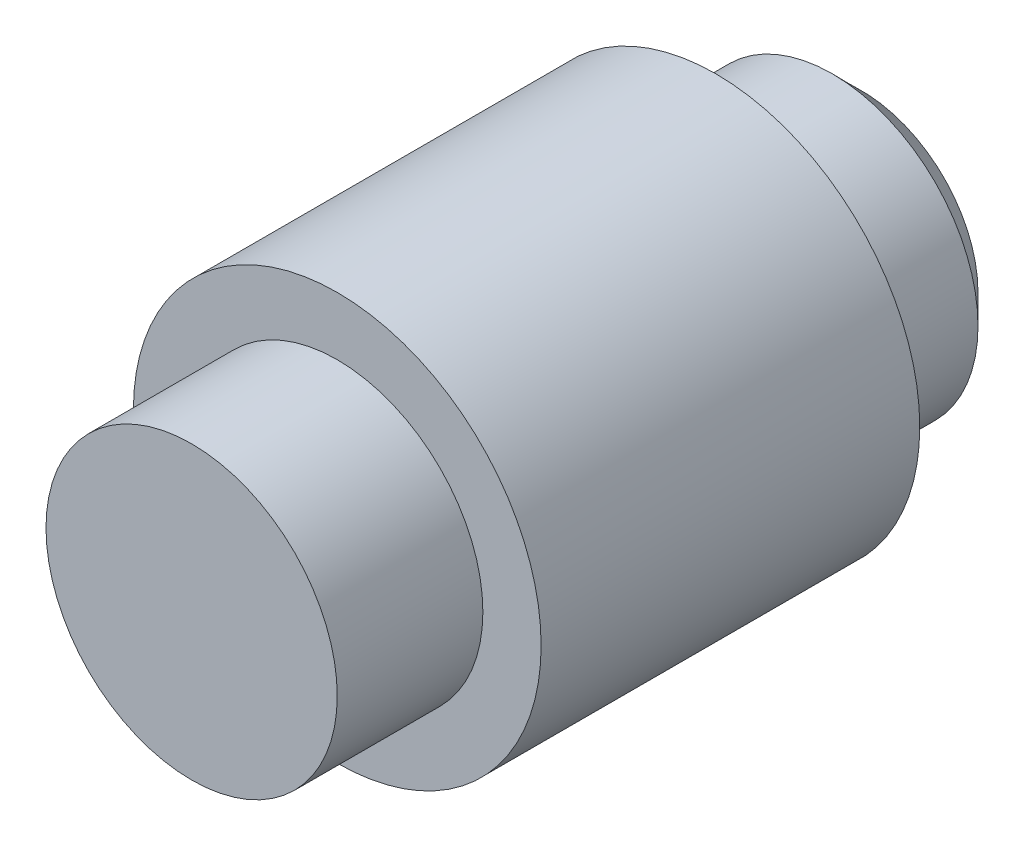
from build123d import *

# Parameters (mm, degrees)
SKETCH3_R           = 3.5
BOSS_EXTRUDE1_DEPTH = 6.5
SKETCH4_R           = 2.5
BOSS_EXTRUDE2_DEPTH = 2.5
BOSS_EXTRUDE3_START = 2.5
SKETCH5_R           = 2.5
BOSS_EXTRUDE3_DEPTH = 2.5
CHAMFER1_SIZE       = 0.5


with BuildPart() as part:
    # Sketch3 → Boss-Extrude1 (new body)
    with BuildSketch(Plane.XY):
        Circle(SKETCH3_R)
    extrude(amount=BOSS_EXTRUDE1_DEPTH)

    # Sketch4 → Boss-Extrude2 (add)
    with BuildSketch(Plane.XY):
        Circle(SKETCH4_R)
    extrude(amount=-BOSS_EXTRUDE2_DEPTH)

    # Sketch5 → Boss-Extrude3 (add)
    with BuildSketch(Plane.XY.offset(6.5).offset(BOSS_EXTRUDE3_START)):
        Circle(SKETCH5_R)
    extrude(amount=-BOSS_EXTRUDE3_DEPTH)

    # Chamfer1
    chamfer1_edges = [part.edges().sort_by_distance(p)[0] for p in [
        (-2.5, 0, -2.5),
    ]]
    chamfer(chamfer1_edges, length=CHAMFER1_SIZE)


solid = part.part
